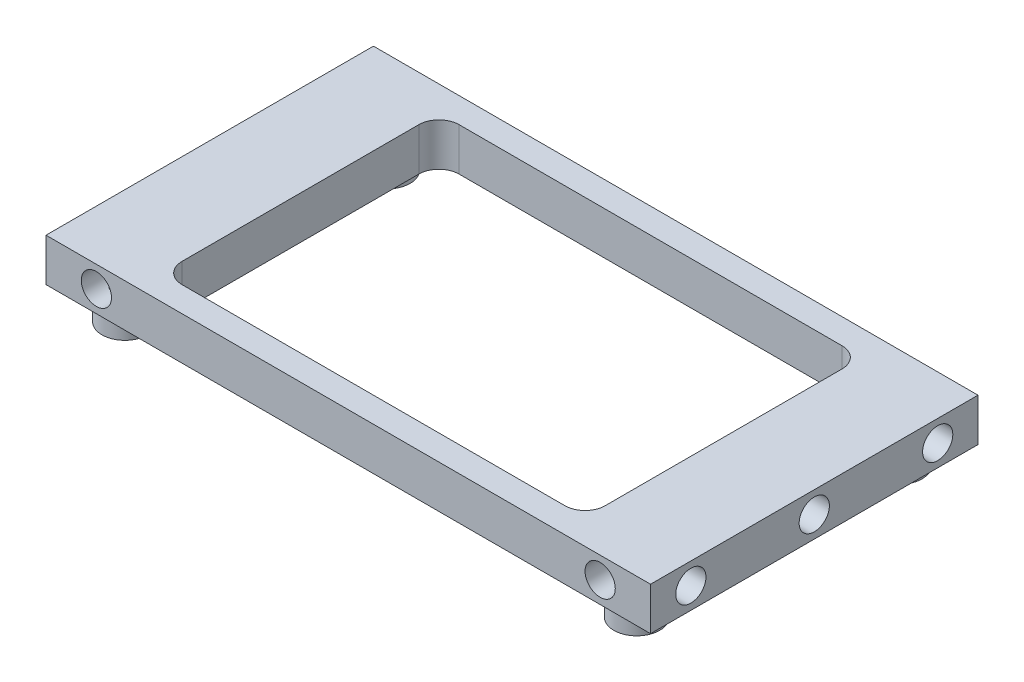
from build123d import *

# Parameters (mm, degrees)
SKETCH1_W                      = 65
SKETCH1_H                      = 8.5
BOSS_EXTRUDE1_DEPTH            = 120
F_6_0MM_DOWEL_HOLE1_AT_2_COUNT = 2
F_6_0MM_DOWEL_HOLE1_AT_2_PITCH = 24.5
F_6_0MM_DOWEL_HOLE1_AT_3_COUNT = 2
F_6_0MM_DOWEL_HOLE1_AT_3_PITCH = 49
F_6_0MM_DOWEL_HOLE2_AT_2_COUNT = 2
F_6_0MM_DOWEL_HOLE2_AT_2_PITCH = 100
CUT_EXTRUDE1_DEPTH             = 125.613402168
F_3_0MM_DOWEL_HOLE1_D          = 3.5
CUT_EXTRUDE2_DEPTH             = 125.613402168
FILLET1_R                      = 6
SKETCH11_R                     = 4.55
SKETCH11_R_2                   = 2.55
BOSS_EXTRUDE2_DEPTH            = 5
CUT_EXTRUDE3_START             = -1.7
SKETCH12_R                     = 2.55
CUT_EXTRUDE3_DEPTH             = 1.7
CHAMFER1_SIZE                  = 1.5
SKETCH13_W                     = 84
SKETCH13_H                     = 55
CUT_EXTRUDE4_DEPTH             = 125.613402291
FILLET2_R                      = 4


with BuildPart() as part:
    # Sketch1 → Boss-Extrude1 (new body)
    with BuildSketch(Plane(origin=(0, 0, 0), x_dir=(0, 0, -1), z_dir=(1, 0, 0))):
        Rectangle(SKETCH1_W, SKETCH1_H)
    extrude(amount=BOSS_EXTRUDE1_DEPTH)

    # Sketch3 → Ø6.0mm Dowel Hole1 (revolve, cut)
    with BuildSketch(Plane(origin=(120, 0, 24.5), x_dir=(0, 0, -1), z_dir=(0, 1, 0))):
        Polygon((0, 0), (0, 11.802581857), (3, 10), (3, 0), align=None)
    f_6_0mm_dowel_hole1 = revolve(axis=Axis((126.35, 0, 24.5), (-1, 0, 0)), mode=Mode.SUBTRACT)

    # Ø6.0mm Dowel Hole1 at 2: Ø6.0mm Dowel Hole1 ×2
    with Locations(*[(0, 0, -i * F_6_0MM_DOWEL_HOLE1_AT_2_PITCH) for i in range(1, F_6_0MM_DOWEL_HOLE1_AT_2_COUNT)]):
        add(f_6_0mm_dowel_hole1, mode=Mode.SUBTRACT)

    # Ø6.0mm Dowel Hole1 at 3: Ø6.0mm Dowel Hole1 ×2
    with Locations(*[(0, 0, -i * F_6_0MM_DOWEL_HOLE1_AT_3_PITCH) for i in range(1, F_6_0MM_DOWEL_HOLE1_AT_3_COUNT)]):
        add(f_6_0mm_dowel_hole1, mode=Mode.SUBTRACT)

    # Mirror1: Ø6.0mm Dowel Hole1 across plane
    add(f_6_0mm_dowel_hole1.mirror(Plane(origin=(60, 0, 0), x_dir=(0, 0, 1), z_dir=(1, 0, 0))), mode=Mode.SUBTRACT)

    # Mirror1 copy 1 sketch → Mirror1 copy 1 (revolve, cut)
    with BuildSketch(Plane(origin=(0, 0, 0), x_dir=(0, 0, -1), z_dir=(0, 1, 0))):
        Polygon((0, 0), (0, -11.802581857), (3, -10), (3, 0), align=None)
    revolve(axis=Axis((-6.35, 0, 0), (-1, 0, 0)), mode=Mode.SUBTRACT)

    # Mirror1 copy 2 sketch → Mirror1 copy 2 (revolve, cut)
    with BuildSketch(Plane(origin=(0, 0, -24.5), x_dir=(0, 0, -1), z_dir=(0, 1, 0))):
        Polygon((0, 0), (0, -11.802581857), (3, -10), (3, 0), align=None)
    revolve(axis=Axis((-6.35, 0, -24.5), (-1, 0, 0)), mode=Mode.SUBTRACT)

    # Sketch5 → Ø6.0mm Dowel Hole2 (revolve, cut)
    with BuildSketch(Plane(origin=(110, 0, -32.5), x_dir=(0, 1, 0), z_dir=(1, 0, 0))):
        Polygon((0, 0), (0, 9.802581857), (3, 8), (3, 0), align=None)
    f_6_0mm_dowel_hole2 = revolve(axis=Axis((110, 0, -38.85), (0, 0, 1)), mode=Mode.SUBTRACT)

    # Ø6.0mm Dowel Hole2 at 2: Ø6.0mm Dowel Hole2 ×2
    with Locations(*[(-i * F_6_0MM_DOWEL_HOLE2_AT_2_PITCH, 0, 0) for i in range(1, F_6_0MM_DOWEL_HOLE2_AT_2_COUNT)]):
        add(f_6_0mm_dowel_hole2, mode=Mode.SUBTRACT)

    # Mirror2: Ø6.0mm Dowel Hole2 across plane
    add(f_6_0mm_dowel_hole2.mirror(Plane.XY), mode=Mode.SUBTRACT)

    # Mirror2 copy 1 sketch → Mirror2 copy 1 (revolve, cut)
    with BuildSketch(Plane(origin=(10, 0, 32.5), x_dir=(0, 1, 0), z_dir=(1, 0, 0))):
        Polygon((0, 0), (0, -9.802581857), (3, -8), (3, 0), align=None)
    revolve(axis=Axis((10, 0, 38.85), (0, 0, 1)), mode=Mode.SUBTRACT)

    # Sketch6 → Cut-Extrude1 (cut, through all)
    with BuildSketch(Plane(origin=(0, 4.25, 0), x_dir=(1, 0, 0), z_dir=(0, 1, 0))):
        with BuildLine():
            Line((80, -7), (80, 7))
            ThreePointArc((80, 7), (86, 13), (92, 7))
            Line((92, 7), (92, -7))
            ThreePointArc((92, -7), (86, -13), (80, -7))
        make_face()
    cut_extrude1 = extrude(amount=-CUT_EXTRUDE1_DEPTH, mode=Mode.SUBTRACT)

    # Mirror3: Cut-Extrude1 across plane
    add(cut_extrude1.mirror(Plane(origin=(60, 0, 0), x_dir=(0, 0, 1), z_dir=(1, 0, 0))), mode=Mode.SUBTRACT)

    # Ø3.0mm Dowel Hole1 (through all)
    with Locations(Plane(origin=(0, 4.25, 0), x_dir=(1, 0, 0), z_dir=(0, 1, 0))):
        with Locations((87, -17), (87, 17), (33, 17), (33, -17), (100, -24.5), (60, -24.5), (20, -24.5), (100, 24.5), (60, 24.5), (20, 24.5)):
            Hole(F_3_0MM_DOWEL_HOLE1_D / 2)

    # Sketch10 → Cut-Extrude2 (cut, through all)
    with BuildSketch(Plane.XZ.offset(4.25)):
        with BuildLine():
            Line((40, 7), (40, -7))
            ThreePointArc((40, -7), (38.242640687, -11.242640687), (34, -13))
            Line((34, -13), (40, -21.5))
            Line((40, -21.5), (80, -21.5))
            Line((80, -21.5), (86, -13))
            ThreePointArc((86, -13), (81.757359313, -11.242640687), (80, -7))
            Line((80, -7), (80, 7))
            ThreePointArc((80, 7), (81.757359313, 11.242640687), (86, 13))
            Line((86, 13), (80, 21.5))
            Line((80, 21.5), (40, 21.5))
            Line((40, 21.5), (34, 13))
            ThreePointArc((34, 13), (38.242640687, 11.242640687), (40, 7))
        make_face()
    extrude(amount=-CUT_EXTRUDE2_DEPTH, mode=Mode.SUBTRACT)

    # Fillet1
    fillet1_edges = [part.edges().sort_by_distance(p)[0] for p in [
        (34, 0, -13),
        (40, 0, -21.5),
        (34, 0, 13),
        (40, 0, 21.5),
        (80, 0, -21.5),
        (86, 0, -13),
        (80, 0, 21.5),
        (86, 0, 13),
    ]]
    fillet(fillet1_edges, radius=FILLET1_R)

    # Sketch11 → Boss-Extrude2 (add)
    # profile 1 of 4: a face of its own
    with BuildSketch(Plane.XZ.offset(4.25)):
        with Locations((9.2, -26.035)):
            Circle(SKETCH11_R)
        with Locations((9.2, -26.035)):
            Circle(SKETCH11_R_2, mode=Mode.SUBTRACT)
    # profile 2 of 4: a face of its own
    with BuildSketch(Plane.XZ.offset(4.25)):
        with Locations((110.8, -26.035)):
            Circle(SKETCH11_R)
        with Locations((110.8, -26.035)):
            Circle(SKETCH11_R_2, mode=Mode.SUBTRACT)
    # profile 3 of 4: a face of its own
    with BuildSketch(Plane.XZ.offset(4.25)):
        with Locations((9.2, 26.035)):
            Circle(SKETCH11_R)
        with Locations((9.2, 26.035)):
            Circle(SKETCH11_R_2, mode=Mode.SUBTRACT)
    # profile 4 of 4: a face of its own
    with BuildSketch(Plane.XZ.offset(4.25)):
        with Locations((110.8, 26.035)):
            Circle(SKETCH11_R)
        with Locations((110.8, 26.035)):
            Circle(SKETCH11_R_2, mode=Mode.SUBTRACT)
    extrude(amount=BOSS_EXTRUDE2_DEPTH)

    # Sketch12 → Cut-Extrude3 (cut)
    with BuildSketch(Plane.XZ.offset(4.25).offset(CUT_EXTRUDE3_START)):
        with Locations((110.8, -26.035)):
            Circle(SKETCH12_R)
        with Locations((110.8, 26.035)):
            Circle(SKETCH12_R)
        with Locations((9.2, 26.035)):
            Circle(SKETCH12_R)
        with Locations((9.2, -26.035)):
            Circle(SKETCH12_R)
    extrude(amount=CUT_EXTRUDE3_DEPTH, mode=Mode.SUBTRACT)

    # Chamfer1
    chamfer1_edges = [part.edges().sort_by_distance(p)[0] for p in [
        (4.65, -4.25, -26.035),
        (106.25, -4.25, -26.035),
        (106.25, -4.25, 26.035),
        (4.65, -4.25, 26.035),
    ]]
    chamfer(chamfer1_edges, length=CHAMFER1_SIZE)

    # Sketch13 → Cut-Extrude4 (cut, through all)
    with BuildSketch(Plane.XZ.offset(4.25)):
        with Locations((60, 0)):
            Rectangle(SKETCH13_W, SKETCH13_H)
    extrude(amount=-CUT_EXTRUDE4_DEPTH, mode=Mode.SUBTRACT)

    # Fillet2
    fillet2_edges = [part.edges().sort_by_distance(p)[0] for p in [
        (102, 0, -27.5),
        (18, 0, -27.5),
        (18, 0, 27.5),
        (102, 0, 27.5),
    ]]
    fillet(fillet2_edges, radius=FILLET2_R)


solid = part.part
